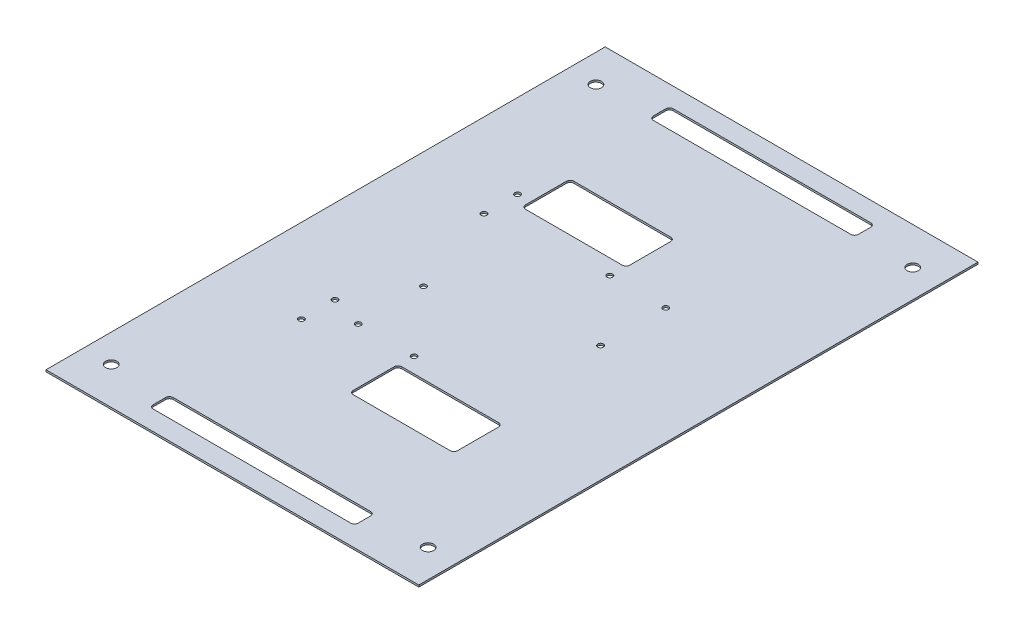
from build123d import *

# Parameters (mm, degrees)
ESQUISSE1_W        = 200
ESQUISSE1_H        = 300
ESQUISSE1_R        = 1.5
ESQUISSE1_R_2      = 3
BOSS_EXTRU_1_DEPTH = 1


with BuildPart() as part:
    # Esquisse1 → Boss.-Extru.1 (new body)
    with BuildSketch(Plane(origin=(0, 0, 0), x_dir=(1, 0, 0), z_dir=(0, 1, 0))):
        Rectangle(ESQUISSE1_W, ESQUISSE1_H)
        with Locations((-37.5, -45)):
            Circle(ESQUISSE1_R, mode=Mode.SUBTRACT)
        with Locations((-7.5, -45)):
            Circle(ESQUISSE1_R, mode=Mode.SUBTRACT)
        with Locations((-37.5, -10)):
            Circle(ESQUISSE1_R, mode=Mode.SUBTRACT)
        with Locations((37.5, 10)):
            Circle(ESQUISSE1_R, mode=Mode.SUBTRACT)
        with Locations((37.5, 45)):
            Circle(ESQUISSE1_R, mode=Mode.SUBTRACT)
        with Locations((7.5, 45)):
            Circle(ESQUISSE1_R, mode=Mode.SUBTRACT)
        with Locations((85, 130)):
            Circle(ESQUISSE1_R_2, mode=Mode.SUBTRACT)
        with Locations((-85, 130)):
            Circle(ESQUISSE1_R_2, mode=Mode.SUBTRACT)
        with Locations((85, -130)):
            Circle(ESQUISSE1_R_2, mode=Mode.SUBTRACT)
        with Locations((-85, -130)):
            Circle(ESQUISSE1_R_2, mode=Mode.SUBTRACT)
        with Locations((-55, 40)):
            Circle(ESQUISSE1_R, mode=Mode.SUBTRACT)
        with Locations((-55, 58)):
            Circle(ESQUISSE1_R, mode=Mode.SUBTRACT)
        with Locations((-55, -58)):
            Circle(ESQUISSE1_R, mode=Mode.SUBTRACT)
        with Locations((-55, -40)):
            Circle(ESQUISSE1_R, mode=Mode.SUBTRACT)
        with BuildLine():
            Line((-6, -53.175), (46, -53.175))
            ThreePointArc((46, -53.175), (47.414213562, -53.760786438), (48, -55.175))
            Line((48, -55.175), (48, -77.175))
            ThreePointArc((48, -77.175), (47.414213562, -78.589213562), (46, -79.175))
            Line((46, -79.175), (-6, -79.175))
            ThreePointArc((-6, -79.175), (-7.414213562, -78.589213562), (-8, -77.175))
            Line((-8, -77.175), (-8, -55.175))
            ThreePointArc((-8, -55.175), (-7.414213562, -53.760786438), (-6, -53.175))
        make_face(mode=Mode.SUBTRACT)
        with BuildLine():
            Line((-46, 79.175), (6, 79.175))
            ThreePointArc((6, 79.175), (7.414213562, 78.589213562), (8, 77.175))
            Line((8, 77.175), (8, 55.175))
            ThreePointArc((8, 55.175), (7.414213562, 53.760786438), (6, 53.175))
            Line((6, 53.175), (-46, 53.175))
            ThreePointArc((-46, 53.175), (-47.414213562, 53.760786438), (-48, 55.175))
            Line((-48, 55.175), (-48, 77.175))
            ThreePointArc((-48, 77.175), (-47.414213562, 78.589213562), (-46, 79.175))
        make_face(mode=Mode.SUBTRACT)
        with BuildLine():
            Line((-53, -139.5000508), (53, -139.5000508))
            ThreePointArc((53, -139.5000508), (54.414213562, -138.914264362), (55, -137.5000508))
            Line((55, -137.5000508), (55, -130.772848254))
            ThreePointArc((55, -130.772848254), (54.414213562, -129.358634692), (53, -128.772848254))
            Line((53, -128.772848254), (-53, -128.772848254))
            ThreePointArc((-53, -128.772848254), (-54.414213562, -129.358634692), (-55, -130.772848254))
            Line((-55, -130.772848254), (-55, -137.5000508))
            ThreePointArc((-55, -137.5000508), (-54.414213562, -138.914264362), (-53, -139.5000508))
        make_face(mode=Mode.SUBTRACT)
        with BuildLine():
            Line((-55, 137.5000508), (-55, 130.772848254))
            ThreePointArc((-55, 130.772848254), (-54.414213562, 129.358634692), (-53, 128.772848254))
            Line((-53, 128.772848254), (53, 128.772848254))
            ThreePointArc((53, 128.772848254), (54.414213562, 129.358634692), (55, 130.772848254))
            Line((55, 130.772848254), (55, 137.5000508))
            ThreePointArc((55, 137.5000508), (54.414213562, 138.914264362), (53, 139.5000508))
            Line((53, 139.5000508), (-53, 139.5000508))
            ThreePointArc((-53, 139.5000508), (-54.414213562, 138.914264362), (-55, 137.5000508))
        make_face(mode=Mode.SUBTRACT)
    extrude(amount=BOSS_EXTRU_1_DEPTH)


solid = part.part
